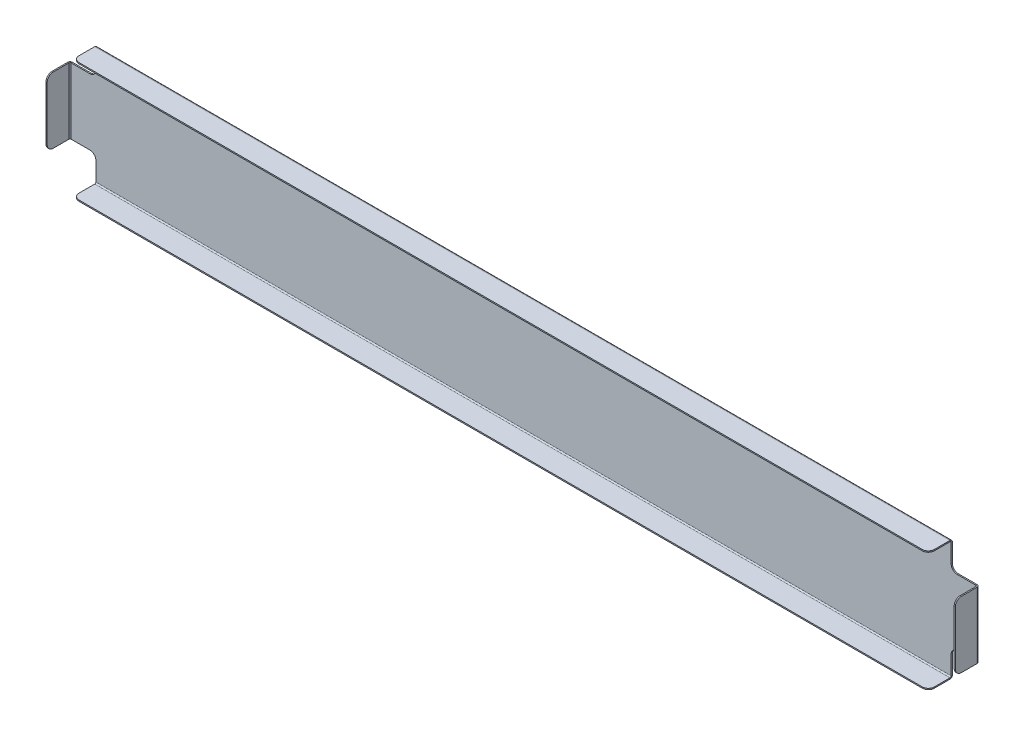
from build123d import *

# Parameters (mm, degrees)
BASE_FLANGE1_DEPTH             = 2
EDGE_FLANGE1_STRIP_W           = 12
EDGE_FLANGE1_STRIP_H           = 2
EDGE_FLANGE1_STRIP_CUT_DEPTH   = 1422.8
EDGE_FLANGE1_STRIP_2_W         = 12
EDGE_FLANGE1_STRIP_2_H         = 2
EDGE_FLANGE1_STRIP_CUT_2_DEPTH = 110
EDGE_FLANGE1_STRIP_3_W         = 12
EDGE_FLANGE1_STRIP_3_H         = 2
EDGE_FLANGE1_STRIP_CUT_3_DEPTH = 1422.8
EDGE_FLANGE1_STRIP_4_W         = 12
EDGE_FLANGE1_STRIP_4_H         = 2
EDGE_FLANGE1_STRIP_CUT_4_DEPTH = 110
EDGE_FLANGE1_DEPTH             = 1422.8
EDGE_FLANGE1_BEND_DEPTH        = 110
EDGE_FLANGE1_BEND_2_DEPTH      = 1422.8
EDGE_FLANGE1_BEND_3_DEPTH      = 110
FILLET1_R                      = 10


# Sheet-metal steps are written as plain solids
with BuildPart() as part:
    # Sketch1 → Base-Flange1 (new body)
    with BuildSketch(Plane.XY):
        Polygon((-711.4, -100), (711.4, -100), (711.4, -55), (756.4, -55), (756.4, 55), (711.4, 55), (711.4, 100), (-711.4, 100), (-711.4, 55), (-756.4, 55), (-756.4, -55), (-711.4, -55), align=None)
    extrude(amount=-BASE_FLANGE1_DEPTH)

    # Edge-Flange1 strip (across the edge) → Edge-Flange1 strip cut (cut)
    with BuildSketch(Plane(origin=(711.4, 100, 0), x_dir=(0, -1, 0), z_dir=(-1, 0, 0))):
        with Locations((-2, -1)):
            Rectangle(EDGE_FLANGE1_STRIP_W, EDGE_FLANGE1_STRIP_H)
    extrude(amount=EDGE_FLANGE1_STRIP_CUT_DEPTH, mode=Mode.SUBTRACT)

    # Edge-Flange1 strip 2 (across the edge) → Edge-Flange1 strip cut 2 (cut)
    with BuildSketch(Plane(origin=(756.4, -55, 0), x_dir=(-1, 0, 0), z_dir=(0, 1, 0))):
        with Locations((-2, -1)):
            Rectangle(EDGE_FLANGE1_STRIP_2_W, EDGE_FLANGE1_STRIP_2_H)
    extrude(amount=EDGE_FLANGE1_STRIP_CUT_2_DEPTH, mode=Mode.SUBTRACT)

    # Edge-Flange1 strip 3 (across the edge) → Edge-Flange1 strip cut 3 (cut)
    with BuildSketch(Plane(origin=(-711.4, -100, 0), x_dir=(0, 1, 0), z_dir=(1, 0, 0))):
        with Locations((-2, -1)):
            Rectangle(EDGE_FLANGE1_STRIP_3_W, EDGE_FLANGE1_STRIP_3_H)
    extrude(amount=EDGE_FLANGE1_STRIP_CUT_3_DEPTH, mode=Mode.SUBTRACT)

    # Edge-Flange1 strip 4 (across the edge) → Edge-Flange1 strip cut 4 (cut)
    with BuildSketch(Plane(origin=(-756.4, 55, 0), x_dir=(1, 0, 0), z_dir=(0, -1, 0))):
        with Locations((-2, -1)):
            Rectangle(EDGE_FLANGE1_STRIP_4_W, EDGE_FLANGE1_STRIP_4_H)
    extrude(amount=EDGE_FLANGE1_STRIP_CUT_4_DEPTH, mode=Mode.SUBTRACT)

    # Edge-Flange1 section (across the edge) → Edge-Flange1 (add)
    with BuildSketch(Plane(origin=(711.4, 100, 0), x_dir=(0, -1, 0), z_dir=(-1, 0, 0))):
        with BuildLine():
            Line((0, 2), (0, 38))
            Line((0, 38), (2, 38))
            Line((2, 38), (2, 2))
            ThreePointArc((2, 2), (2.585786438, 0.585786438), (4, 0))
            Line((4, 0), (4, -2))
            ThreePointArc((4, -2), (1.171572875, -0.828427125), (0, 2))
        make_face()
    extrude(amount=EDGE_FLANGE1_DEPTH)

    # Edge-Flange1 section 2 (across the edge) → Edge-Flange1 bend (add)
    with BuildSketch(Plane(origin=(756.4, -55, 0), x_dir=(-1, 0, 0), z_dir=(0, 1, 0))):
        with BuildLine():
            Line((0, 2), (0, 38))
            Line((0, 38), (2, 38))
            Line((2, 38), (2, 2))
            ThreePointArc((2, 2), (2.585786438, 0.585786438), (4, 0))
            Line((4, 0), (4, -2))
            ThreePointArc((4, -2), (1.171572875, -0.828427125), (0, 2))
        make_face()
    extrude(amount=EDGE_FLANGE1_BEND_DEPTH)

    # Edge-Flange1 section 3 (across the edge) → Edge-Flange1 bend 2 (add)
    with BuildSketch(Plane(origin=(-711.4, -100, 0), x_dir=(0, 1, 0), z_dir=(1, 0, 0))):
        with BuildLine():
            Line((0, 2), (0, 38))
            Line((0, 38), (2, 38))
            Line((2, 38), (2, 2))
            ThreePointArc((2, 2), (2.585786438, 0.585786438), (4, 0))
            Line((4, 0), (4, -2))
            ThreePointArc((4, -2), (1.171572875, -0.828427125), (0, 2))
        make_face()
    extrude(amount=EDGE_FLANGE1_BEND_2_DEPTH)

    # Edge-Flange1 section 4 (across the edge) → Edge-Flange1 bend 3 (add)
    with BuildSketch(Plane(origin=(-756.4, 55, 0), x_dir=(1, 0, 0), z_dir=(0, -1, 0))):
        with BuildLine():
            Line((0, 2), (0, 38))
            Line((0, 38), (2, 38))
            Line((2, 38), (2, 2))
            ThreePointArc((2, 2), (2.585786438, 0.585786438), (4, 0))
            Line((4, 0), (4, -2))
            ThreePointArc((4, -2), (1.171572875, -0.828427125), (0, 2))
        make_face()
    extrude(amount=EDGE_FLANGE1_BEND_3_DEPTH)

    # Fillet1
    fillet1_edges = [part.edges().sort_by_distance(p)[0] for p in [
        (755.4, -55, 38),
        (755.4, 55, 38),
        (-711.4, -99, 38),
        (711.4, -99, 38),
        (-755.4, 55, 38),
        (-755.4, -55, 38),
        (711.4, 55, -1),
        (711.4, -55, -1),
        (-711.4, -55, -1),
        (-711.4, 55, -1),
        (711.4, 99, 38),
        (-711.4, 99, 38),
    ]]
    fillet(fillet1_edges, radius=FILLET1_R)


solid = part.part
